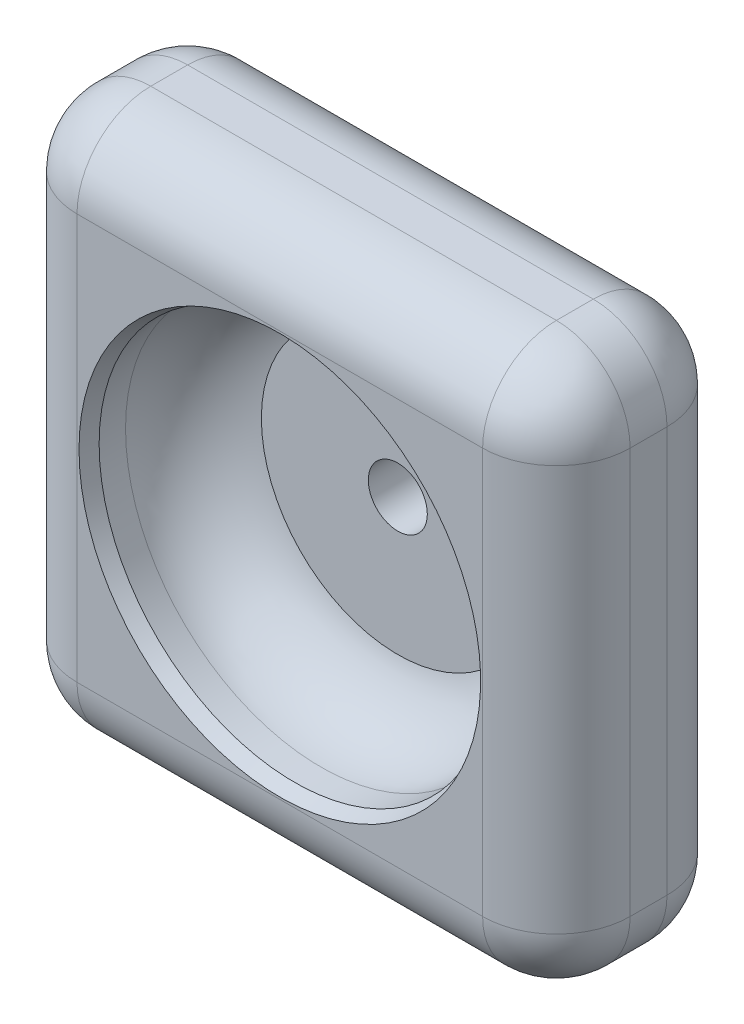
from build123d import *

# Parameters (mm, degrees)
SKETCH1_W           = 75
SKETCH1_H           = 75
BOSS_EXTRUDE1_DEPTH = 25
FILLET2_R           = 10
CUT_EXTRUDE1_START  = -2
SKETCH5_R           = 4
CUT_EXTRUDE1_DEPTH  = 16
CHAMFER2_SIZE       = 2
CHAMFER2_SIZE2      = 0.727940469


with BuildPart() as part:
    # Sketch1 → Boss-Extrude1 (new body)
    with BuildSketch(Plane(origin=(0, 0, 0), x_dir=(0, 1, 0), z_dir=(0, 0, 1))):
        Rectangle(SKETCH1_W, SKETCH1_H)
    extrude(amount=BOSS_EXTRUDE1_DEPTH)

    # Sketch4 → Cut-Revolve2 (revolve, cut)
    with BuildSketch(Plane(origin=(0, 0, 0), x_dir=(0, -1, 0), z_dir=(-1, 0, 0))):
        with BuildLine():
            Line((0, 25), (0, 9))
            Line((0, 9), (-18.5, 9))
            ThreePointArc((-18.5, 9), (-24.269303538, 12.850991806), (-26.5, 19.41902001))
            Line((-26.5, 19.41902001), (-26.5, 25))
            Line((-26.5, 25), (0, 25))
        make_face()
    revolve(axis=Axis((0, 0, 0), (0, 0, 1)), mode=Mode.SUBTRACT)

    # Fillet2
    fillet2_edges = [part.edges().sort_by_distance(p)[0] for p in [
        (0, -37.5, 25),
        (0, -37.5, 0),
        (37.5, -37.5, 12.5),
        (37.5, 0, 25),
        (37.5, 0, 0),
        (-37.5, 0, 25),
        (-37.5, -37.5, 12.5),
        (-37.5, 0, 0),
        (37.5, 37.5, 12.5),
        (0, 37.5, 25),
        (-37.5, 37.5, 12.5),
        (0, 37.5, 0),
    ]]
    fillet(fillet2_edges, radius=FILLET2_R)

    # Sketch5 → Cut-Extrude1 (cut)
    with BuildSketch(Plane(origin=(0, 0, 0), x_dir=(1, 0, 0), z_dir=(0, 0, -1)).offset(CUT_EXTRUDE1_START)):
        Circle(SKETCH5_R)
    extrude(amount=-CUT_EXTRUDE1_DEPTH, mode=Mode.SUBTRACT)

    # Chamfer2
    chamfer2_edges = [part.edges().sort_by_distance(p)[0] for p in [
        (0, -26.5, 25),
    ]]
    chamfer2_side = [part.faces().sort_by_distance(p)[0] for p in [
        (0, -26.5, 22.209510005),
    ]]
    chamfer(chamfer2_edges, length=CHAMFER2_SIZE, length2=CHAMFER2_SIZE2, reference=chamfer2_side[0])


solid = part.part
